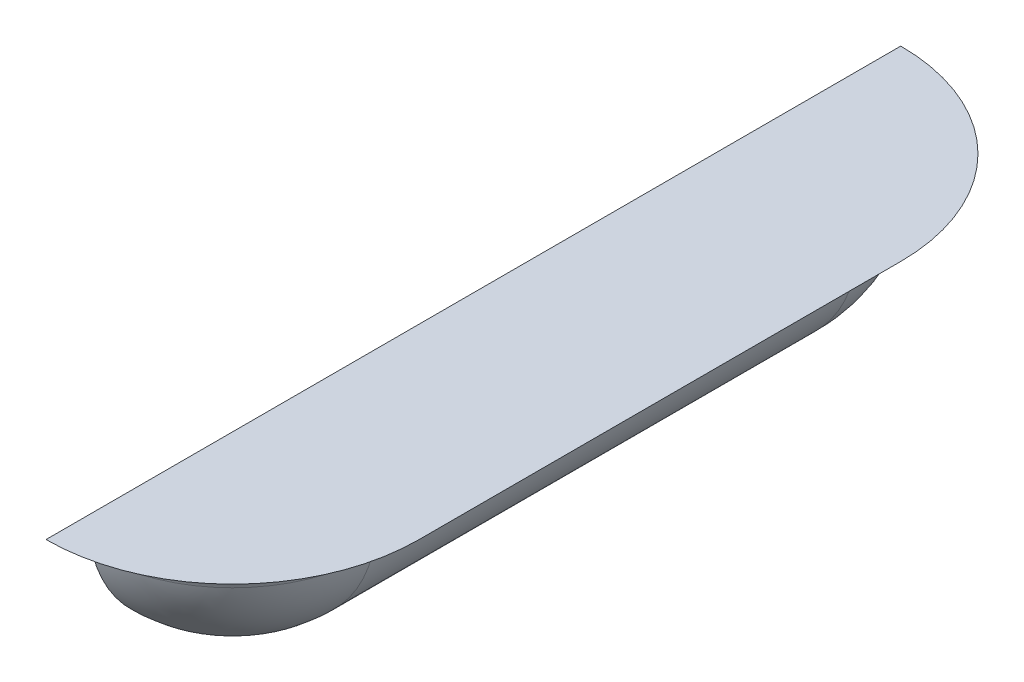
from build123d import *

# Parameters (mm, degrees)
SKETCH1_W           = 30
SKETCH1_H           = 3.464243611
BASE_EXTRUDE_DEPTH  = 25
BOSS_EXTRUDE1_DEPTH = 10
BOSS_REVOLVE2_ANGLE = 90
BOSS_REVOLVE3_ANGLE = 90
FILLET1_R           = 2
SKETCH8_W           = 50
SKETCH8_H           = 3.464243611
CUT_EXTRUDE4_DEPTH  = 40.509492685


with BuildPart() as part:
    # Sketch1 → Base-Extrude (new, symmetric)
    with BuildSketch(Plane.XY):
        with Locations((0, 1.732121806)):
            Rectangle(SKETCH1_W, SKETCH1_H)
    extrude(amount=BASE_EXTRUDE_DEPTH, both=True)

    # Louver Body → Boss-Extrude1 (add, symmetric)
    with BuildSketch(Plane.XY):
        with BuildLine():
            Line((-3, 0), (-3, -6))
            ThreePointArc((-3, -6), (1.242640687, -4.242640687), (3, 0))
            Line((3, 0), (-3, 0))
        make_face()
    extrude(amount=BOSS_EXTRUDE1_DEPTH, both=True)

    # Sketch12 → Boss-Revolve2 (revolve)
    with BuildSketch(Plane.XY.offset(10)):
        with BuildLine():
            Line((3, 0), (-3, 0))
            Line((-3, 0), (-3, -6))
            ThreePointArc((-3, -6), (1.242640687, -4.242640687), (3, 0))
        make_face()
    revolve(axis=Axis((-3, 0, 10), (0, -1, 0)), revolution_arc=BOSS_REVOLVE2_ANGLE)

    # Sketch13 → Boss-Revolve3 (revolve)
    with BuildSketch(Plane(origin=(0, 0, -10), x_dir=(-1, 0, 0), z_dir=(0, 0, -1))):
        with BuildLine():
            Line((3, 0), (-3, 0))
            ThreePointArc((-3, 0), (-1.242640687, -4.242640687), (3, -6))
            Line((3, -6), (3, 0))
        make_face()
    revolve(axis=Axis((-3, -6, -10), (0, 1, 0)), revolution_arc=BOSS_REVOLVE3_ANGLE)

    # Fillet1
    fillet1_edges = [part.edges().sort_by_distance(p)[0] for p in [
        (1.242640687, 0, 14.242640687),
        (3, 0, 0),
        (1.242640687, 0, -14.242640687),
    ]]
    fillet(fillet1_edges, radius=FILLET1_R)

    # Sketch8 → Cut-Extrude4 (cut, through all)
    with BuildSketch(Plane.ZY.offset(15)):
        with Locations((0, 1.732121806)):
            Rectangle(SKETCH8_W, SKETCH8_H)
    extrude(amount=-CUT_EXTRUDE4_DEPTH, mode=Mode.SUBTRACT)


solid = part.part
